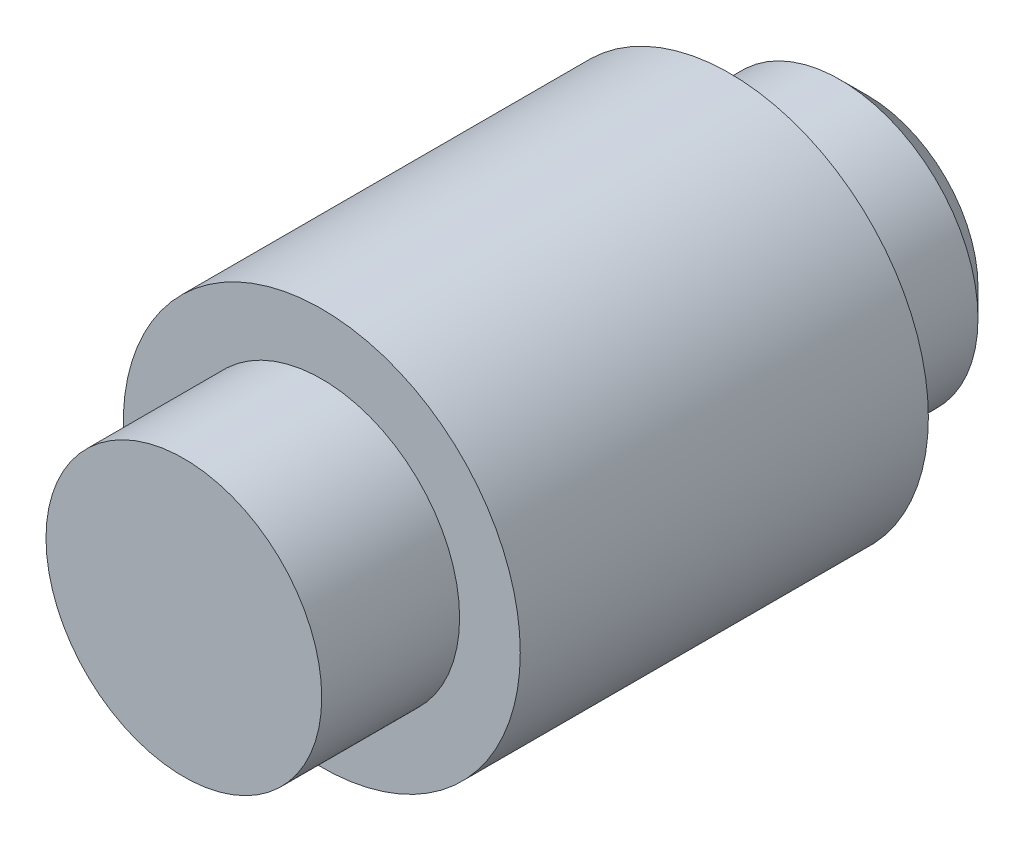
from build123d import *

# Parameters (mm, degrees)
SKETCH3_R           = 3.6
BOSS_EXTRUDE1_DEPTH = 7.4
SKETCH4_R           = 2.5
BOSS_EXTRUDE2_DEPTH = 2.5
BOSS_EXTRUDE3_START = 2.5
SKETCH5_R           = 2.5
BOSS_EXTRUDE3_DEPTH = 2.5
CHAMFER1_SIZE       = 0.5


with BuildPart() as part:
    # Sketch3 → Boss-Extrude1 (new body)
    with BuildSketch(Plane.XY):
        Circle(SKETCH3_R)
    extrude(amount=BOSS_EXTRUDE1_DEPTH)

    # Sketch4 → Boss-Extrude2 (add)
    with BuildSketch(Plane.XY):
        Circle(SKETCH4_R)
    extrude(amount=-BOSS_EXTRUDE2_DEPTH)

    # Sketch5 → Boss-Extrude3 (add)
    with BuildSketch(Plane.XY.offset(7.4).offset(BOSS_EXTRUDE3_START)):
        Circle(SKETCH5_R)
    extrude(amount=-BOSS_EXTRUDE3_DEPTH)

    # Chamfer1
    chamfer1_edges = [part.edges().sort_by_distance(p)[0] for p in [
        (-2.5, 0, -2.5),
    ]]
    chamfer(chamfer1_edges, length=CHAMFER1_SIZE)


solid = part.part
